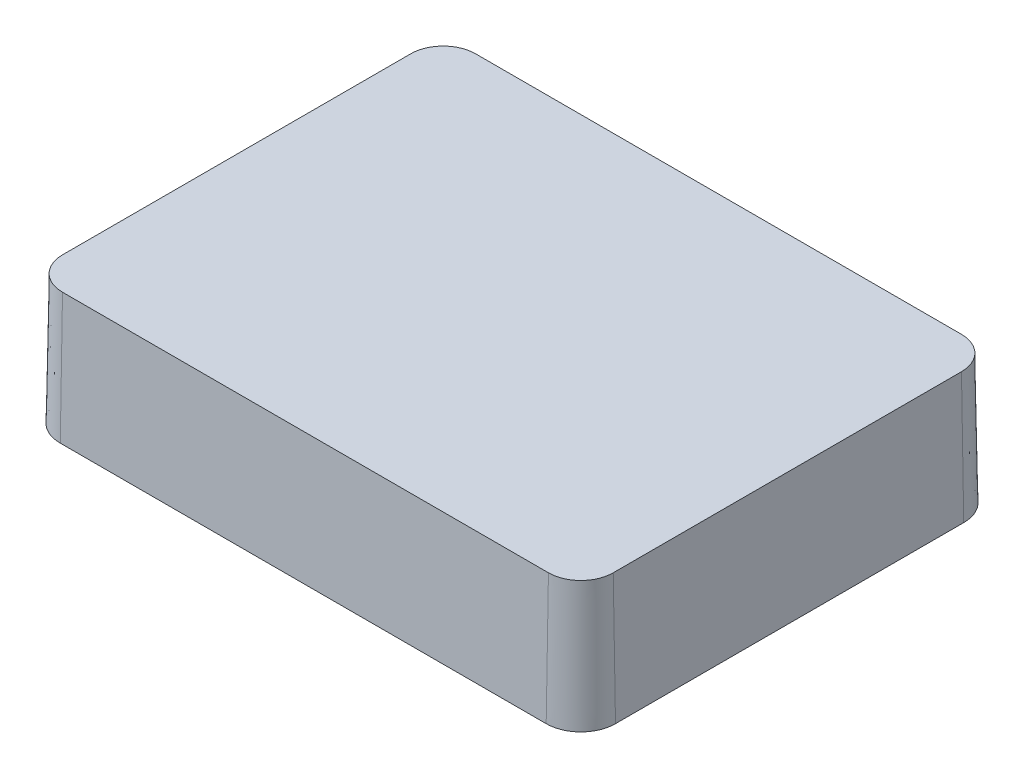
from build123d import *

# Parameters (mm, degrees)
BOSS_EXTRUDE1_DEPTH = 4
BOSS_EXTRUDE1_DRAFT = 1
SHELL1_T            = -0.5
SKETCH2_R           = 2
BOSS_EXTRUDE2_DEPTH = 5.5
BOSS_EXTRUDE2_TAPER = 1.5
CIRPATTERN1_COUNT   = 4


with BuildPart() as part:
    # Sketch1 → Boss-Extrude1 (with draft: the straight prism first)
    with BuildSketch(Plane(origin=(0, 0, 0), x_dir=(1, 0, 0), z_dir=(0, 1, 0))):
        with BuildLine():
            Line((-7.5, -6.375), (7.5, -6.375))
            ThreePointArc((7.5, -6.375), (8.207106781, -6.082106781), (8.5, -5.375))
            Line((8.5, -5.375), (8.5, 5.375))
            ThreePointArc((8.5, 5.375), (8.207106781, 6.082106781), (7.5, 6.375))
            Line((7.5, 6.375), (-7.5, 6.375))
            ThreePointArc((-7.5, 6.375), (-8.207106781, 6.082106781), (-8.5, 5.375))
            Line((-8.5, 5.375), (-8.5, -5.375))
            ThreePointArc((-8.5, -5.375), (-8.207106781, -6.082106781), (-7.5, -6.375))
        make_face()
    extrude(amount=-BOSS_EXTRUDE1_DEPTH)
    # Boss-Extrude1: the draft: its side faces are tilted about the plane it starts from
    boss_extrude1_sides = [part.faces().sort_by_distance(p)[0] for p in [
        (0, -2, 6.375),
        (8.207106781, -2, 6.082106781),
        (8.5, -2, 0),
        (8.207106781, -2, -6.082106781),
        (0, -2, -6.375),
        (-8.207106781, -2, -6.082106781),
        (-8.5, -2, 0),
        (-8.207106781, -2, 6.082106781),
    ]]
    draft(boss_extrude1_sides, Plane(origin=(0, 0, 0), x_dir=(1, 0, 0), z_dir=(0, 1, 0)), BOSS_EXTRUDE1_DRAFT)

    # Shell1
    shell1_openings = [part.faces().sort_by_distance(p)[0] for p in [
        (0, -4, 0),
    ]]
    offset(amount=SHELL1_T, openings=shell1_openings, kind=Kind.INTERSECTION)

    # Sketch2 → Boss-Extrude2 (add)
    with BuildSketch(Plane.XZ.offset(0.5)):
        Circle(SKETCH2_R)
    extrude(amount=BOSS_EXTRUDE2_DEPTH, taper=BOSS_EXTRUDE2_TAPER)

    # Rib1: read off the stored shape, not the designer's step
    # Rib1: loft between two sections, ruled curve by curve
    rib1_from = [
        Edge.make_line((1.982020638, -0.5, 0.267570907), (3, -0.5, 0.25)),
        Edge.make_line((1.982020638, -0.5, -0.267570907), (3, -0.5, -0.25)),
        Edge.make_line((3, -0.5, -0.25), (3, -0.5, 0.25)),
        Edge.make_line((1.982020638, -0.5, -0.267570907), (1.982020638, -0.5, 0.267570907)),
    ]
    rib1_to = [
        Edge.make_line((1.87747837, -4.5, 0.258981593), (2.397831467, -4.5, 0.25)),
        Edge.make_line((1.87747837, -4.5, -0.258981593), (2.397831467, -4.5, -0.25)),
        Edge.make_line((2.397831467, -4.5, -0.25), (2.397831467, -4.5, 0.25)),
        Edge.make_line((1.87747837, -4.5, -0.258981593), (1.87747837, -4.5, 0.258981593)),
    ]
    rib1 = Solid(Shell([*[Face.make_surface_from_curves(rib1_from[k], rib1_to[k]) for k in range(4)], Face(Wire(rib1_from)), Face(Wire(rib1_to))]))
    add(rib1)

    # CirPattern1: Rib1 ×4 about axis
    cirpattern1_axis = Axis((0, 0, 0), (0, 1, 0))
    for i in range(1, CIRPATTERN1_COUNT):
        add(rib1.rotate(cirpattern1_axis, i * 360 / CIRPATTERN1_COUNT))


solid = part.part
